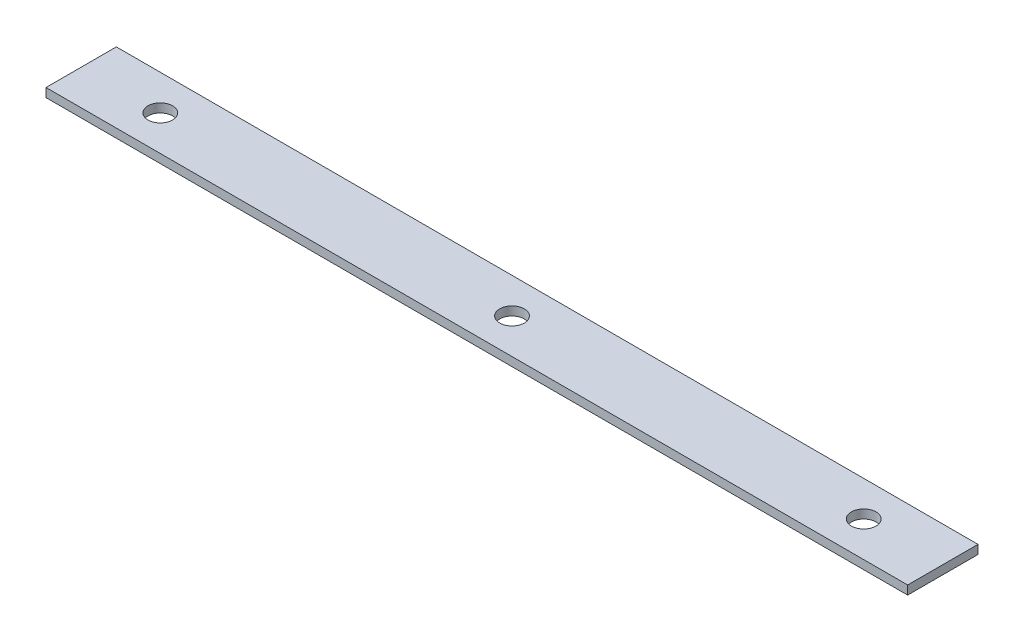
from build123d import *

# Parameters (mm, degrees)
SKETCH1_W            = 245
SKETCH1_H            = 20
BASE_FLANGE1_DEPTH   = 2.5
SKETCH6_R            = 3.5
CUT_EXTRUDE1_DEPTH   = 10
LPATTERN1_COUNT      = 6
LPATTERN1_PITCH      = 146
LPATTERN1_COUNT_DIR2 = 6
LPATTERN1_PITCH_DIR2 = 146
LPATTERN2_COUNT      = 2
LPATTERN2_PITCH      = 100
LPATTERN2_COL_COUNT  = 2
LPATTERN2_COL_PITCH  = 100


# Sheet-metal steps are written as plain solids
with BuildPart() as part:
    # Sketch1 → Base-Flange1 (new body)
    with BuildSketch(Plane(origin=(0, 0, 0), x_dir=(1, 0, 0), z_dir=(0, 1, 0))):
        Rectangle(SKETCH1_W, SKETCH1_H)
    extrude(amount=-BASE_FLANGE1_DEPTH)

    # Sketch6 → Cut-Extrude1 (cut)
    with BuildSketch(Plane(origin=(0, 0, 0), x_dir=(1, 0, 0), z_dir=(0, 1, 0))):
        with Locations(Location((0, 0, 0), (0, 0, 270))):
            Circle(SKETCH6_R)
    cut_extrude1 = extrude(amount=-CUT_EXTRUDE1_DEPTH, mode=Mode.SUBTRACT)

    # LPattern1: Cut-Extrude1 6 × 6
    with Locations(*[Vector(-1, 0, 0) * (i * LPATTERN1_PITCH) + Vector(1, 0, 0) * (j * LPATTERN1_PITCH_DIR2) for i in range(LPATTERN1_COUNT) for j in range(LPATTERN1_COUNT_DIR2) if (i, j) != (0, 0)]):
        add(cut_extrude1, mode=Mode.SUBTRACT)

    # LPattern2: Cut-Extrude1 ×2
    with Locations(*[(-i * LPATTERN2_PITCH, 0, 0) for i in range(1, LPATTERN2_COUNT)]):
        add(cut_extrude1, mode=Mode.SUBTRACT)

    # LPattern2 col: Cut-Extrude1 ×2
    with Locations(*[(i * LPATTERN2_COL_PITCH, 0, 0) for i in range(1, LPATTERN2_COL_COUNT)]):
        add(cut_extrude1, mode=Mode.SUBTRACT)


solid = part.part
